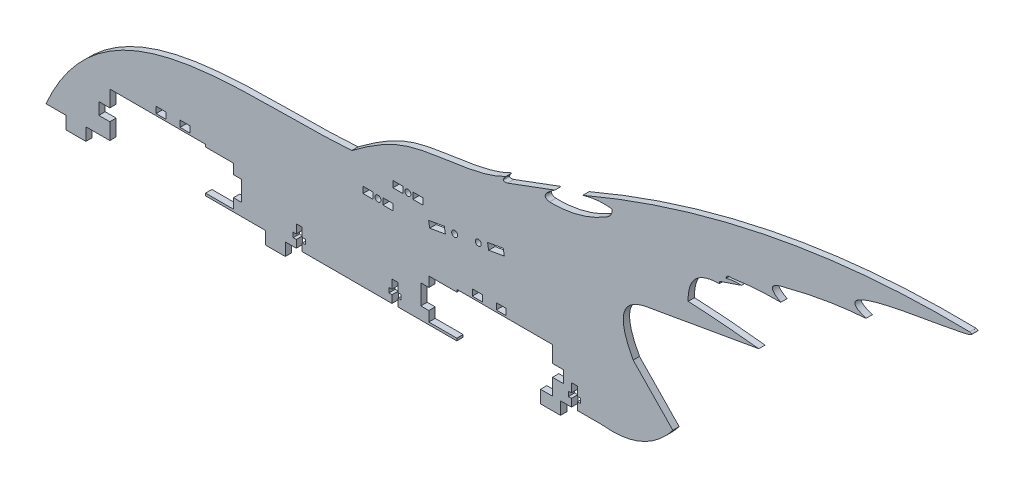
from build123d import *

# Parameters (mm, degrees)
BOSS_EXTRUDE1_DEPTH = 3.175
SKETCH3_W           = 10
SKETCH3_H           = 6.35
BOSS_EXTRUDE2_DEPTH = 3.175
CUT_EXTRUDE1_DEPTH  = 1
CUT_EXTRUDE2_DEPTH  = 309.914260869
SKETCH7_W           = 5
SKETCH7_H           = 3.175
CUT_EXTRUDE3_DEPTH  = 309.914260869
SKETCH8_R           = 1.5
CUT_EXTRUDE4_DEPTH  = 309.914260869
SKETCH11_R          = 1.5
SKETCH11_W          = 5
SKETCH11_H          = 3.175
CUT_EXTRUDE5_DEPTH  = 309.914260869


with BuildPart() as part:
    # Sketch2 → Boss-Extrude1 (new body)
    with BuildSketch(Plane.XY):
        with BuildLine():
            Line((-171.469047232, -34.076589663), (107.072734851, -34.076589663))
            add(Edge.make_bspline(
                [(107.072734851, -34.076589663), (128.968224532, -36.583015685), (142.892082906, -18.715522774)],
                knots=[0, 0, 0, 1, 1, 1], degree=2))
            Line((142.892082906, -18.715522774), (122.99960361, 1.8225486))
            add(Edge.make_bspline(
                [(129.812103759, 28.346921979), (110.367502019, 24.835662341), (122.99960361, 1.8225486)],
                knots=[0, 0, 0, 1, 1, 1], degree=2))
            Line((129.812103759, 28.346921979), (185.982982819, 38.244685161))
            add(Edge.make_bspline(
                [(150.588622768, 41.132714976), (168.332466646, 40.241827569), (185.982982819, 38.244685161)],
                knots=[0, 0, 0, 1, 1, 1], degree=2))
            add(Edge.make_bspline(
                [(166.211544782, 56.600045126), (150.111599454, 56.448151942), (150.588622768, 41.132714976)],
                knots=[0, 0, 0, 1, 1, 1], degree=2))
            Line((166.211544782, 56.600045126), (166.232711914, 57.669663084))
            Line((166.232711914, 57.669663084), (177.243348067, 61.403308501))
            add(Edge.make_bspline(
                [(177.243348067, 61.403308501), (173.339529375, 61.796609349), (169.627135034, 60.610840144)],
                knots=[0, 0, 0, 1, 1, 1], degree=2))
            add(Edge.make_bspline(
                [(169.627135034, 60.610840144), (169.762853876, 62.544945332), (172.402329475, 62.156522878)],
                knots=[0, 0, 0, 1, 1, 1], degree=2))
            add(Edge.make_bspline(
                [(172.402329475, 62.156522878), (184.617311888, 64.041519989), (197.029812567, 63.947302758)],
                knots=[0, 0, 0, 1, 1, 1], degree=2))
            add(Edge.make_bspline(
                [(197.029812567, 63.947302758), (187.73474396, 69.069639789), (198.964387884, 71.402059066)],
                knots=[0, 0, 0, 1, 1, 1], degree=2))
            add(Edge.make_bspline(
                [(198.964387884, 71.402059066), (219.003547299, 76.786528717), (239.76459105, 78.329887141)],
                knots=[0, 0, 0, 1, 1, 1], degree=2))
            add(Edge.make_bspline(
                [(291.780939868, 98.47138823), (303.090852198, 95.717715254), (210.844028254, 88.026417155), (239.76459105, 78.329887141)],
                knots=[0, 0, 0, 0, 1, 1, 1, 1], degree=3))
            add(Edge.make_bspline(
                [(291.780939868, 98.47138823), (190.608851514, 100.539390251), (97.737935683, 60.775941524)],
                knots=[0, 0, 0, 1, 1, 1], degree=2))
            add(Edge.make_bspline(
                [(97.737935683, 60.775941524), (104.92881908, 63.001143493), (112.379572637, 62.156522878)],
                knots=[0, 0, 0, 1, 1, 1], degree=2))
            add(Edge.make_bspline(
                [(112.379572637, 62.156522878), (112.730110756, 59.051830939), (109.55036868, 57.311722682)],
                knots=[0, 0, 0, 1, 1, 1], degree=2))
            add(Edge.make_bspline(
                [(109.55036868, 57.311722682), (96.530025853, 49.246897899), (81.058579137, 49.55282081)],
                knots=[0, 0, 0, 1, 1, 1], degree=2))
            add(Edge.make_bspline(
                [(81.058579137, 49.55282081), (75.642299748, 50.628036984), (83.696612356, 55.998318906)],
                knots=[0, 0, 0, 1, 1, 1], degree=2))
            Line((83.696612356, 55.998318906), (60.023408157, 47.198036308))
            add(Edge.make_bspline(
                [(60.023408157, 47.198036308), (56.150260782, 46.24516321), (59.12376331, 49.613311176)],
                knots=[0, 0, 0, 1, 1, 1], degree=2))
            add(Edge.make_bspline(
                [(59.12376331, 49.613311176), (44.292473838, 41.921501166), (13.209344651, 43.405332099), (-7.707186428, 29.993825045), (-18.106560521, 22.301338951)],
                knots=[0, 0, 0, 0, 0.606338938, 1, 1, 1, 1], degree=3))
            add(Edge.make_bspline(
                [(-18.106560521, 22.301338951), (-73.30010729, 18.178725753), (-142.381543794, 32.928841514), (-171.469047232, -34.076589663)],
                knots=[0, 0, 0, 0, 1, 1, 1, 1], degree=3))
        make_face()
    extrude(amount=BOSS_EXTRUDE1_DEPTH)

    # Sketch3 → Boss-Extrude2 (add)
    with BuildSketch(Plane.XY.offset(3.175)):
        with Locations((-156.469047232, -37.251589663)):
            Rectangle(SKETCH3_W, SKETCH3_H)
        with Locations((-56.469047232, -37.251589663)):
            Rectangle(SKETCH3_W, SKETCH3_H)
        with Locations((81.530952768, -37.251589663)):
            Rectangle(SKETCH3_W, SKETCH3_H)
    extrude(amount=-BOSS_EXTRUDE2_DEPTH)

    # Sketch4 → Cut-Extrude1 (cut)
    with BuildSketch(Plane.XY):
        with BuildLine():
            Line((-8.735344321, 21.076667257), (49.27249451, 25.443679203))
            add(Edge.make_bspline(
                [(55.435775055, 40.720887474), (56.710717132, 34.955549426), (51.7521577, 29.95185464), (49.27249451, 25.443679203)],
                knots=[0, 0, 0, 0, 1, 1, 1, 1], degree=3))
            add(Edge.make_bspline(
                [(55.435775055, 40.720887474), (33.054612951, 40.360145045), (7.874054379, 39.272954497), (-8.735344321, 21.076667257)],
                knots=[0, 0, 0, 0, 1, 1, 1, 1], degree=3))
        make_face()
    extrude(amount=CUT_EXTRUDE1_DEPTH, mode=Mode.SUBTRACT)

    # Sketch5 → Cut-Extrude2 (cut, through all)
    with BuildSketch(Plane.XY.offset(3.175)):
        Polygon((-45.969047232, -34.076589663), (-42.969047232, -34.076589663), (-42.969047232, -30.276589663), (-41.419047232, -30.276589663), (-41.419047232, -27.876589663), (-42.969047232, -27.876589663), (-42.969047232, -23.426589663), (-45.969047232, -23.426589663), (-45.969047232, -27.876589663), (-47.519047232, -27.876589663), (-47.519047232, -30.276589663), (-45.969047232, -30.276589663), align=None)
        Polygon((2.030952768, -30.276589663), (2.030952768, -34.076589663), (5.030952768, -34.076589663), (5.030952768, -30.276589663), (6.580952768, -30.276589663), (6.580952768, -27.876589663), (5.030952768, -27.876589663), (5.030952768, -23.426589663), (2.030952768, -23.426589663), (2.030952768, -27.876589663), (0.480952768, -27.876589663), (0.480952768, -30.276589663), align=None)
        Polygon((92.030952768, -30.276589663), (92.030952768, -34.076589663), (95.030952768, -34.076589663), (95.030952768, -30.276589663), (96.580952768, -30.276589663), (96.580952768, -27.876589663), (95.030952768, -27.876589663), (95.030952768, -23.426589663), (92.030952768, -23.426589663), (92.030952768, -27.876589663), (90.480952768, -27.876589663), (90.480952768, -30.276589663), align=None)
    extrude(amount=-CUT_EXTRUDE2_DEPTH, mode=Mode.SUBTRACT)

    # Sketch7 → Cut-Extrude3 (cut, through all)
    with BuildSketch(Plane.XY.offset(3.175)):
        Polygon((-91.469047232, -32.876589663), (-77.469047232, -32.876589663), (-77.469047232, -27.876589663), (-73.469047232, -27.876589663), (-73.469047232, -17.876589663), (-77.469047232, -17.876589663), (-77.469047232, -12.876589663), (-91.469047232, -12.876589663), (-91.469047232, -11.676589663), (-139.469047232, -11.676589663), (-139.469047232, -19.876589663), (-144.969047232, -19.876589663), (-144.969047232, -25.876589663), (-139.469047232, -25.876589663), (-139.469047232, -34.076589663), (-91.469047232, -34.076589663), align=None)
        Polygon((20.530952768, -27.876589663), (20.530952768, -32.876589663), (34.530952768, -32.876589663), (34.530952768, -34.076589663), (82.530952768, -34.076589663), (82.530952768, -25.876589663), (88.030952768, -25.876589663), (88.030952768, -19.876589663), (82.530952768, -19.876589663), (82.530952768, -11.676589663), (34.530952768, -11.676589663), (34.530952768, -12.876589663), (20.530952768, -12.876589663), (20.530952768, -17.876589663), (16.530952768, -17.876589663), (16.530952768, -27.876589663), align=None)
        with Locations((-113.769047232, -9.149089663)):
            Rectangle(SKETCH7_W, SKETCH7_H)
        with Locations((-101.769047232, -9.149089663)):
            Rectangle(SKETCH7_W, SKETCH7_H)
        with Locations((44.830952768, -9.149089663)):
            Rectangle(SKETCH7_W, SKETCH7_H)
        with Locations((56.830952768, -9.149089663)):
            Rectangle(SKETCH7_W, SKETCH7_H)
    extrude(amount=-CUT_EXTRUDE3_DEPTH, mode=Mode.SUBTRACT)

    # Sketch8 → Cut-Extrude4 (cut, through all)
    with BuildSketch(Plane(origin=(0, 0, 0), x_dir=(-1, 0, 0), z_dir=(0, 0, -1))):
        with Locations((-33.483463602, 11.904038041)):
            Circle(SKETCH8_R)
        with Locations((-45.301156639, 13.987816173)):
            Circle(SKETCH8_R)
        Polygon((-20.405296331, 11.209994039), (-20.956629295, 8.083229423), (-28.835091319, 9.472414844), (-28.283758355, 12.59917946), align=None)
        Polygon((-49.949528922, 16.419439369), (-50.500861886, 13.292674753), (-58.37932391, 14.681860174), (-57.827990946, 17.80862479), align=None)
    extrude(amount=-CUT_EXTRUDE4_DEPTH, mode=Mode.SUBTRACT)

    # Sketch11 → Cut-Extrude5 (cut, through all)
    with BuildSketch(Plane.XY.offset(3.175)):
        with Locations((10, 18)):
            Circle(SKETCH11_R)
        with Locations((-5, 8)):
            Circle(SKETCH11_R)
        with Locations((15, 18)):
            Rectangle(SKETCH11_W, SKETCH11_H)
        with Locations((5, 18)):
            Rectangle(SKETCH11_W, SKETCH11_H)
        with Locations((-10, 8)):
            Rectangle(SKETCH11_W, SKETCH11_H)
        with Locations((0, 8)):
            Rectangle(SKETCH11_W, SKETCH11_H)
    extrude(amount=-CUT_EXTRUDE5_DEPTH, mode=Mode.SUBTRACT)


solid = part.part
